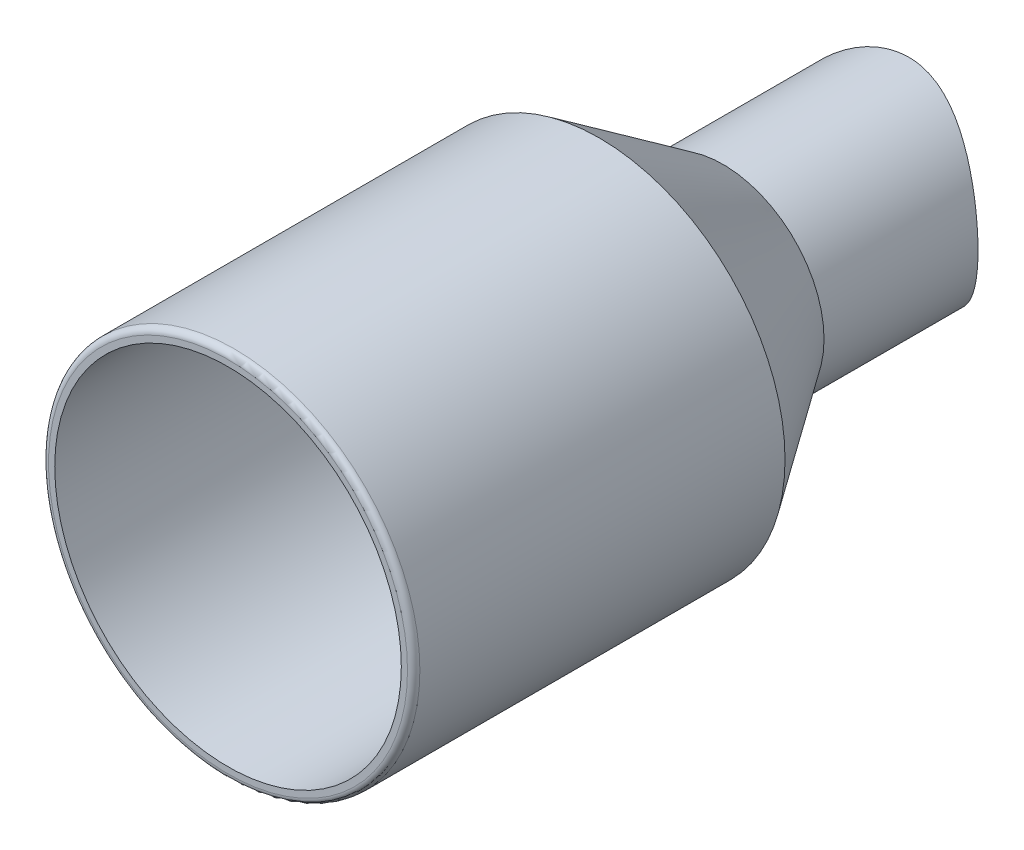
from build123d import *
from build123d.topology import SkipClean

# Parameters (mm, degrees)
SKETCH1_R               = 15
SKETCH1_R_2             = 14
BOSS_EXTRUDE1_DEPTH     = 30
FILLET1_R               = 0.5
CUT_EXTRUDE1_DEPTH      = 10
CUT_EXTRUDE1_DEPTH_BACK = 10
SKETCH6_R               = 14.25
BOSS_EXTRUDE2_START     = -40
BOSS_EXTRUDE2_DEPTH     = 7
CHAMFER1_SIZE           = 1


with BuildPart() as part:
    # Sketch1 → Boss-Extrude1 (new body)
    with BuildSketch(Plane.XY):
        Circle(SKETCH1_R)
        Circle(SKETCH1_R_2, mode=Mode.SUBTRACT)
    extrude(amount=BOSS_EXTRUDE1_DEPTH)

    # Fillet1
    fillet1_edges = [part.edges().sort_by_distance(p)[0] for p in [
        (-15, 0, 30),
    ]]
    fillet(fillet1_edges, radius=FILLET1_R)

    # Sketch5 → Revolve1 (revolve)
    with BuildSketch(Plane(origin=(0, 0, 0), x_dir=(0, 0, -1), z_dir=(1, 0, 0))):
        Polygon((0, 14), (10, 7.15), (25, 7.15), (25, 8.15), (10, 8.15), (0, 15), align=None)
    revolve(axis=Axis((0, 0, 0), (0, 0, -1)))

    # Sketch6 → Cut-Extrude1 (cut, two sides: drawn at the far end of the back side and taken through both)
    with BuildSketch(Plane(origin=(0, 0, 0), x_dir=(0, 0, -1), z_dir=(1, 0, 0)).offset(-CUT_EXTRUDE1_DEPTH_BACK)):
        with Locations((36.689311357, 0)):
            Circle(SKETCH6_R)
    extrude(amount=CUT_EXTRUDE1_DEPTH + CUT_EXTRUDE1_DEPTH_BACK, mode=Mode.SUBTRACT)

    # Sketch7 → Boss-Extrude2 (add)
    with SkipClean():  # the faces are left unmerged after this step: merging them gives an invalid solid
        with BuildSketch(Plane.XY.offset(30).offset(BOSS_EXTRUDE2_START)):
            with BuildLine():
                Line((-8.088417645, -1), (-5.15, -1))
                Line((-5.15, -1), (-5.15, 1))
                Line((-5.15, 1), (-8.088417645, 1))
                ThreePointArc((-8.088417645, 1), (-8.15, 0), (-8.088417645, -1))
            make_face()
            with BuildLine():
                Line((5.15, -1), (8.088417645, -1))
                ThreePointArc((8.088417645, -1), (8.15, 0), (8.088417645, 1))
                Line((8.088417645, 1), (5.15, 1))
                Line((5.15, 1), (5.15, -1))
            make_face()
        extrude(amount=-BOSS_EXTRUDE2_DEPTH)

    # Chamfer1
    chamfer1_edges = [part.edges().sort_by_distance(p)[0] for p in [
        (-5.15, 0, -17),
        (5.15, 0, -17),
    ]]
    chamfer(chamfer1_edges, length=CHAMFER1_SIZE)


solid = part.part
